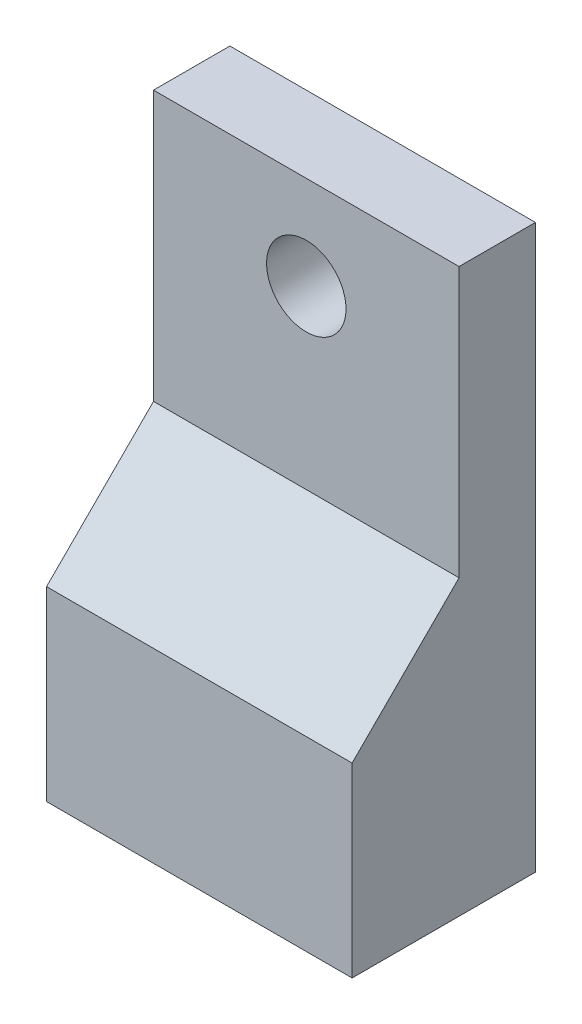
from build123d import *

# Parameters (mm, degrees)
SKICA1_W                = 20
SKICA1_H                = 36.830083089
SKICA1_R                = 2.6
P_IDAT_VYSUNUT_M1_DEPTH = 5
SKICA2_W                = 20
SKICA2_H                = 19.184386705
P_IDAT_VYSUNUT_M2_DEPTH = 7
ZKOSEN_1_SIZE           = 7


with BuildPart() as part:
    # Skica1 → Přidat vysunutím1 (new body)
    with BuildSketch(Plane.XY):
        with Locations((14.524287798, -297.284958456)):
            Rectangle(SKICA1_W, SKICA1_H)
        with Locations((14.524287798, -284.981509323)):
            Circle(SKICA1_R, mode=Mode.SUBTRACT)
    extrude(amount=P_IDAT_VYSUNUT_M1_DEPTH)

    # Skica2 → Přidat vysunutím2 (add)
    with BuildSketch(Plane.XY.offset(5)):
        with Locations((14.524287798, -306.107806648)):
            Rectangle(SKICA2_W, SKICA2_H)
    extrude(amount=P_IDAT_VYSUNUT_M2_DEPTH)

    # Zkosení1
    zkosen_1_edges = [part.edges().sort_by_distance(p)[0] for p in [
        (14.524287798, -296.515613295, 12),
    ]]
    chamfer(zkosen_1_edges, length=ZKOSEN_1_SIZE - 0.0001)  # a hair under: the kernel refuses the full size


solid = part.part
